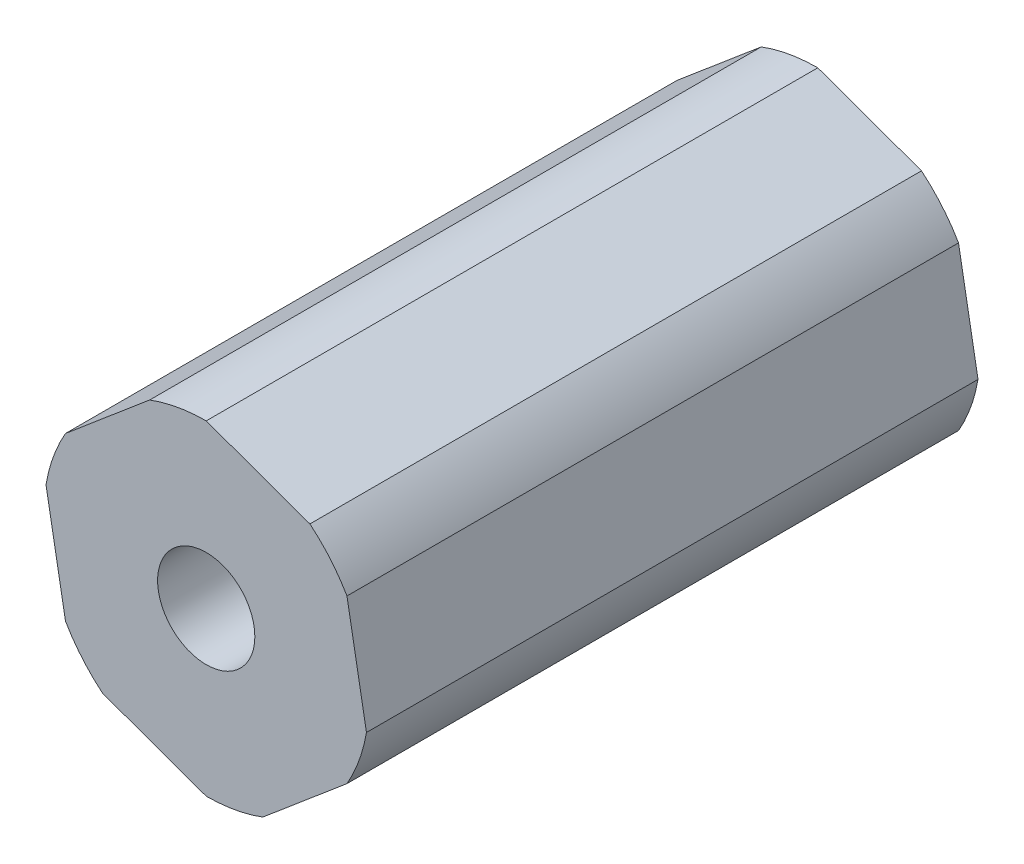
from build123d import *

# Parameters (mm, degrees)
BOSS_EXTRUDE1_DEPTH = 25.4
SKETCH2_R           = 2.0193
CUT_EXTRUDE1_DEPTH  = 28.110983267


with BuildPart() as part:
    # Sketch1 → Boss-Extrude1 (new body)
    with BuildSketch(Plane.XY):
        with BuildLine():
            Line((-6.654540832, 1.131188008), (-5.845671476, -3.375))
            ThreePointArc((-5.845671476, -3.375), (-5.15742276, -4.354709), (-4.306907968, -5.197407407))
            Line((-4.306907968, -5.197407407), (0, -6.75))
            ThreePointArc((0, -6.75), (1.19257724, -6.643813628), (2.347632865, -6.328595415))
            Line((2.347632865, -6.328595415), (5.845671476, -3.375))
            ThreePointArc((5.845671476, -3.375), (6.35, -2.289104628), (6.654540832, -1.131188008))
            Line((6.654540832, -1.131188008), (5.845671476, 3.375))
            ThreePointArc((5.845671476, 3.375), (5.15742276, 4.354709), (4.306907968, 5.197407407))
            Line((4.306907968, 5.197407407), (0, 6.75))
            ThreePointArc((0, 6.75), (-1.19257724, 6.643813628), (-2.347632865, 6.328595415))
            Line((-2.347632865, 6.328595415), (-5.845671476, 3.375))
            ThreePointArc((-5.845671476, 3.375), (-6.35, 2.289104628), (-6.654540832, 1.131188008))
        make_face()
    extrude(amount=BOSS_EXTRUDE1_DEPTH)

    # Sketch2 → Cut-Extrude1 (cut, through all)
    with BuildSketch(Plane.XY.offset(25.4)):
        Circle(SKETCH2_R)
    extrude(amount=-CUT_EXTRUDE1_DEPTH, mode=Mode.SUBTRACT)


solid = part.part
